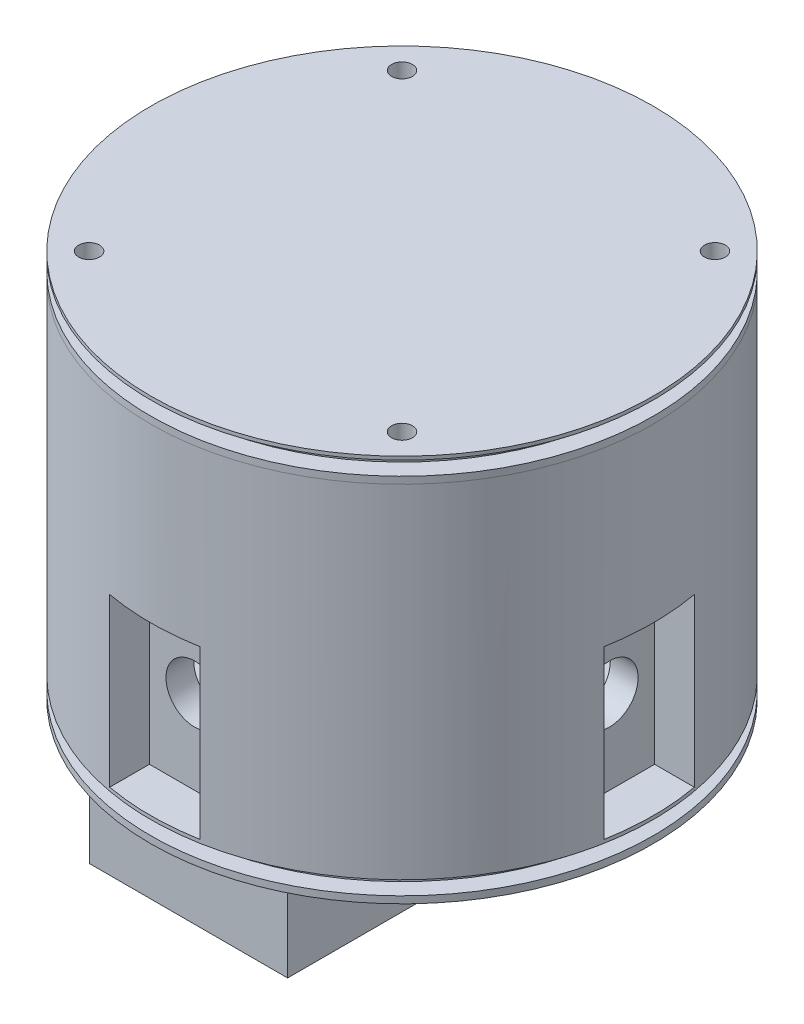
from build123d import *

# Parameters (mm, degrees)
EXTRUDE_START            = -2
SKETCH_1_R               = 72.25
EXTRUDE_8_DEPTH          = 99.5
SKETCH_5_W               = 10.5
SKETCH_5_H               = 22
SKETCH_5_W_2             = 22
SKETCH_5_H_2             = 10.5
CUT_EXTRUDE_1_DEPTH      = 48
SKETCH_40_R              = 8.25
CUT_EXTRUDE_2_DEPTH      = 8
PATTERN_CIRCULAR_1_COUNT = 4
SHELL_START              = -49.642711667
SHELL_6_OUTLINE_W        = 30
SHELL_6_OUTLINE_H        = 50
SHELL_6_DEPTH            = 99.285423334
SHELL_START_2            = -57.642711667
SHELL_6_2_OUTLINE_W      = 30
SHELL_6_2_OUTLINE_H      = 50
SHELL_6_2_OUTLINE_R      = 10.25
SHELL_6_2_DEPTH          = 115.285423334
SHELL_6_3_OUTLINE_W      = 50
SHELL_6_3_OUTLINE_H      = 30
SHELL_6_3_DEPTH          = 99.285423334
SHELL_6_4_OUTLINE_W      = 50
SHELL_6_4_OUTLINE_H      = 30
SHELL_6_4_OUTLINE_R      = 10.25
SHELL_6_4_DEPTH          = 115.285423334
SHELL_6_5_DEPTH          = 97.5
SHELL_START_3            = 50
SHELL_6_6_DEPTH          = 47.5
CUT_EXTRUDE_5_DEPTH      = 48
SKETCH_37_W              = 68
SKETCH_37_H              = 1.5
EXTRUDE_9_DEPTH          = 34
EXTRUDE_9_2_DEPTH        = 34
EXTRUDE_9_3_DEPTH        = 34
EXTRUDE_9_4_DEPTH        = 34
EXTRUDE_9_5_DEPTH        = 34
EXTRUDE_10_DEPTH         = 65
EXTRUDE_11_DEPTH         = 55
EXTRUDE_START_2          = -6
SKETCH_1_26_R            = 72.25
EXTRUDE_13_DEPTH         = 6
SKETCH_47_W              = 57
SKETCH_47_H              = 106
EXTRUDE_12_DEPTH         = 34
SKETCH_50_R              = 6
CUT_EXTRUDE_6_DEPTH      = 6
EXTRUDE_START_3          = 91.5
SKETCH_1_36_R            = 72.25
SKETCH_1_36_R_2          = 71
SKETCH_1_36_R_3          = 68
EXTRUDE_19_DEPTH         = 6
SKETCH_61_R              = 1.5
CUT_EXTRUDE_10_DEPTH     = 6
CUT_EXTRUDE_START        = 95.5
SKETCH_1_37_R            = 71
SKETCH_1_37_R_2          = 68
CUT_EXTRUDE_11_DEPTH     = 2
EXTRUDE_START_4          = -103.5
EXTRUDE_20_DEPTH         = 6
EXTRUDE_20_2_DEPTH       = 6
EXTRUDE_20_3_DEPTH       = 6
EXTRUDE_20_4_DEPTH       = 6
SKETCH_62_W              = 5
SKETCH_62_H              = 4
SKETCH_63_R              = 1.5
CUT_EXTRUDE_12_DEPTH     = 6
EXTRUDE_START_5          = 97.5
SKETCH_1_39_R            = 72.25
EXTRUDE_22_DEPTH         = 7
SKETCH_64_R              = 3
CUT_EXTRUDE_13_DEPTH     = 6
SKETCH_63_2_R            = 1.5
CUT_EXTRUDE_14_DEPTH     = 6
CUT_EXTRUDE_START_2      = -6
SKETCH_65_R              = 1.5
CUT_EXTRUDE_15_DEPTH     = 6
EXTRUDE_START_6          = -7
SKETCH_1_40_R            = 72.25
EXTRUDE_23_DEPTH         = 1
SKETCH_66_W              = 5
SKETCH_66_H              = 4
SKETCH_1_41_R            = 68
SKETCH_1_41_R_2          = 67
EXTRUDE_24_DEPTH         = 6


with BuildPart() as part:
    # 草圖1 → 填料-伸長8 (new body)
    with BuildSketch(Plane(origin=(0, 0, 0), x_dir=(1, 0, 0), z_dir=(0, 1, 0)).offset(EXTRUDE_START)):
        with Locations(Location((0, 0, 0), (0, 0, 270))):
            Circle(SKETCH_1_R)
    extrude(amount=EXTRUDE_8_DEPTH)

    # 草圖5 → 除料-伸長1 (cut)
    with BuildSketch(Plane(origin=(0, 0, 0), x_dir=(1, 0, 0), z_dir=(0, 1, 0))):
        with Locations((64.892711667, 0)):
            Rectangle(SKETCH_5_W, SKETCH_5_H)
        with BuildLine():
            ThreePointArc((72.25, 0), (71.954602966, 6.526684613), (71.070827348, 13))
            Line((71.070827348, 13), (59.642711667, 13))
            Line((59.642711667, 13), (59.642711667, 11))
            Line((59.642711667, 11), (70.142711667, 11))
            Line((70.142711667, 11), (70.142711667, -11))
            Line((70.142711667, -11), (59.642711667, -11))
            Line((59.642711667, -11), (59.642711667, -13))
            Line((59.642711667, -13), (71.070827348, -13))
            ThreePointArc((71.070827348, -13), (71.954602966, -6.526684613), (72.25, 0))
        make_face()
        with Locations((0, 64.892711667)):
            Rectangle(SKETCH_5_W_2, SKETCH_5_H_2)
        with BuildLine():
            ThreePointArc((13, 71.070827348), (0, 72.25), (-13, 71.070827348))
            Line((-13, 71.070827348), (-13, 59.642711667))
            Line((-13, 59.642711667), (-11, 59.642711667))
            Line((-11, 59.642711667), (-11, 70.142711667))
            Line((-11, 70.142711667), (11, 70.142711667))
            Line((11, 70.142711667), (11, 59.642711667))
            Line((11, 59.642711667), (13, 59.642711667))
            Line((13, 59.642711667), (13, 71.070827348))
        make_face()
        with Locations((-64.892711667, 0)):
            Rectangle(SKETCH_5_W, SKETCH_5_H)
        with BuildLine():
            Line((-70.142711667, -11), (-70.142711667, 11))
            Line((-70.142711667, 11), (-59.642711667, 11))
            Line((-59.642711667, 11), (-59.642711667, 13))
            Line((-59.642711667, 13), (-71.070827348, 13))
            ThreePointArc((-71.070827348, 13), (-72.25, 0), (-71.070827348, -13))
            Line((-71.070827348, -13), (-59.642711667, -13))
            Line((-59.642711667, -13), (-59.642711667, -11))
            Line((-59.642711667, -11), (-70.142711667, -11))
        make_face()
        with Locations((0, -64.892711667)):
            Rectangle(SKETCH_5_W_2, SKETCH_5_H_2)
        with BuildLine():
            Line((-13, -59.642711667), (-13, -71.070827348))
            ThreePointArc((-13, -71.070827348), (0, -72.25), (13, -71.070827348))
            Line((13, -71.070827348), (13, -59.642711667))
            Line((13, -59.642711667), (11, -59.642711667))
            Line((11, -59.642711667), (11, -70.142711667))
            Line((11, -70.142711667), (-11, -70.142711667))
            Line((-11, -70.142711667), (-11, -59.642711667))
            Line((-11, -59.642711667), (-13, -59.642711667))
        make_face()
    extrude(amount=CUT_EXTRUDE_1_DEPTH, mode=Mode.SUBTRACT)

    # 草圖40 → 除料-伸長2 (cut)
    with BuildSketch(Plane(origin=(0, 0, -59.642711667), x_dir=(-1, 0, 0), z_dir=(0, 0, -1))):
        with Locations((0, 24)):
            Circle(SKETCH_40_R)
    cut_extrude_2 = extrude(amount=-CUT_EXTRUDE_2_DEPTH, mode=Mode.SUBTRACT)

    # 環狀複製排列1: 除料-伸長2 ×4 about axis
    pattern_circular_1_axis = Axis((0, 0, 0), (0, 1, 0))
    for i in range(1, PATTERN_CIRCULAR_1_COUNT):
        add(cut_extrude_2.rotate(pattern_circular_1_axis, i * 360 / PATTERN_CIRCULAR_1_COUNT), mode=Mode.SUBTRACT)

    # 薄殼6: read off the stored shape, not the designer's step
    # 薄殼6 outline → 薄殼6 (cut)
    with BuildSketch(Plane.XY.offset(SHELL_START)):
        with Locations((0, 25)):
            Rectangle(SHELL_6_OUTLINE_W, SHELL_6_OUTLINE_H)
    extrude(amount=SHELL_6_DEPTH, mode=Mode.SUBTRACT)

    # Shell 6 2 outline → Shell 6 2 (cut)
    with BuildSketch(Plane.XY.offset(SHELL_START_2)):
        with Locations((0, 25)):
            Rectangle(SHELL_6_2_OUTLINE_W, SHELL_6_2_OUTLINE_H)
        with Locations((0, 24)):
            Circle(SHELL_6_2_OUTLINE_R, mode=Mode.SUBTRACT)
    extrude(amount=SHELL_6_2_DEPTH, mode=Mode.SUBTRACT)

    # Shell 6 3 outline → Shell 6 3 (cut)
    with BuildSketch(Plane.YZ.offset(SHELL_START)):
        with Locations((25, 0)):
            Rectangle(SHELL_6_3_OUTLINE_W, SHELL_6_3_OUTLINE_H)
    extrude(amount=SHELL_6_3_DEPTH, mode=Mode.SUBTRACT)

    # Shell 6 4 outline → Shell 6 4 (cut)
    with BuildSketch(Plane.YZ.offset(SHELL_START_2)):
        with Locations((25, 0)):
            Rectangle(SHELL_6_4_OUTLINE_W, SHELL_6_4_OUTLINE_H)
        with Locations((24, 0)):
            Circle(SHELL_6_4_OUTLINE_R, mode=Mode.SUBTRACT)
    extrude(amount=SHELL_6_4_DEPTH, mode=Mode.SUBTRACT)

    # Shell 6 5 outline → Shell 6 5 (cut)
    with BuildSketch(Plane(origin=(0, 0, 0), x_dir=(1, 0, 0), z_dir=(0, 1, 0))):
        with BuildLine():
            Line((15, 15), (68.62989509, 15))
            ThreePointArc((68.62989509, 15), (49.674251378, 49.674251378), (15, 68.62989509))
            Line((15, 68.62989509), (15, 15))
        make_face()
        with BuildLine():
            ThreePointArc((15, -68.62989509), (49.674251378, -49.674251378), (68.62989509, -15))
            Line((68.62989509, -15), (15, -15))
            Line((15, -15), (15, -68.62989509))
        make_face()
        with BuildLine():
            Line((-15, 15), (-15, 68.62989509))
            ThreePointArc((-15, 68.62989509), (-49.674251378, 49.674251378), (-68.62989509, 15))
            Line((-68.62989509, 15), (-15, 15))
        make_face()
        with BuildLine():
            ThreePointArc((-68.62989509, -15), (-49.674251378, -49.674251378), (-15, -68.62989509))
            Line((-15, -68.62989509), (-15, -15))
            Line((-15, -15), (-68.62989509, -15))
        make_face()
    extrude(amount=SHELL_6_5_DEPTH, mode=Mode.SUBTRACT)

    # Shell 6 6 outline → Shell 6 6 (cut)
    with BuildSketch(Plane(origin=(0, 0, 0), x_dir=(1, 0, 0), z_dir=(0, 1, 0)).offset(SHELL_START_3)):
        with BuildLine():
            ThreePointArc((68.62989509, -15), (70.25, 0), (68.62989509, 15))
            Line((68.62989509, 15), (15, 15))
            Line((15, 15), (15, 68.62989509))
            ThreePointArc((15, 68.62989509), (0, 70.25), (-15, 68.62989509))
            Line((-15, 68.62989509), (-15, 15))
            Line((-15, 15), (-68.62989509, 15))
            ThreePointArc((-68.62989509, 15), (-70.25, 0), (-68.62989509, -15))
            Line((-68.62989509, -15), (-15, -15))
            Line((-15, -15), (-15, -68.62989509))
            ThreePointArc((-15, -68.62989509), (0, -70.25), (15, -68.62989509))
            Line((15, -68.62989509), (15, -15))
            Line((15, -15), (68.62989509, -15))
        make_face()
    extrude(amount=SHELL_6_6_DEPTH, mode=Mode.SUBTRACT)

    # 草圖43 → 除料-伸長5 (cut)
    with BuildSketch(Plane(origin=(0, 0, 0), x_dir=(1, 0, 0), z_dir=(0, 1, 0))):
        Polygon((15.617248129, 51.642711667), (-24.146545114, 51.642711667), (-51.642711667, 15.617248129), (-51.642711667, -24.146545114), (-15.617248129, -51.642711667), (24.146545114, -51.642711667), (51.642711667, -15.617248129), (51.642711667, 24.146545114), align=None)
    extrude(amount=CUT_EXTRUDE_5_DEPTH, mode=Mode.SUBTRACT)

    # 草圖1<26> → 填料-伸長13 (add)
    with BuildSketch(Plane(origin=(0, 0, 0), x_dir=(1, 0, 0), z_dir=(0, 1, 0)).offset(EXTRUDE_START_2)):
        with Locations(Location((0, 0, 0), (0, 0, 270))):
            Circle(SKETCH_1_26_R)
    extrude(amount=EXTRUDE_13_DEPTH)

    # 草圖50 → 除料-伸長6 (cut)
    with BuildSketch(Plane(origin=(0, 0, 0), x_dir=(1, 0, 0), z_dir=(0, 1, 0))):
        with Locations(Location((18.322761596, 49.972985564, 0), (0, 0, 270))):
            Circle(SKETCH_50_R)
        with Locations(Location((-49.972985564, -18.322761596, 0), (0, 0, 270))):
            Circle(SKETCH_50_R)
    extrude(amount=-CUT_EXTRUDE_6_DEPTH, mode=Mode.SUBTRACT)

    # 草圖1<36> → 填料-伸長19 (add)
    # profile 1 of 2: a face of its own
    with BuildSketch(Plane(origin=(0, 0, 0), x_dir=(1, 0, 0), z_dir=(0, 1, 0)).offset(EXTRUDE_START_3)):
        with Locations(Location((0, 0, 0), (0, 0, 270))):
            Circle(SKETCH_1_36_R)
        Circle(SKETCH_1_36_R_2, mode=Mode.SUBTRACT)
    # profile 2 of 2: a face of its own
    with BuildSketch(Plane(origin=(0, 0, 0), x_dir=(1, 0, 0), z_dir=(0, 1, 0)).offset(EXTRUDE_START_3)):
        Circle(SKETCH_1_36_R_2)
        with Locations(Location((0, 0, 0), (0, 0, 270))):
            Circle(SKETCH_1_36_R_3, mode=Mode.SUBTRACT)
    extrude(amount=EXTRUDE_19_DEPTH)

    # 草圖61 → 除料-伸長10 (cut)
    with BuildSketch(Plane(origin=(0, 0, 0), x_dir=(1, 0, 0), z_dir=(0, 1, 0))):
        with Locations(Location((42.426406871, 0, 0), (0, 0, 270))):
            Circle(SKETCH_61_R)
        with Locations(Location((0, -42.426406871, 0), (0, 0, 270))):
            Circle(SKETCH_61_R)
        with Locations(Location((-42.426406871, 0, 0), (0, 0, 270))):
            Circle(SKETCH_61_R)
        with Locations(Location((0, 42.426406871, 0), (0, 0, 270))):
            Circle(SKETCH_61_R)
    extrude(amount=-CUT_EXTRUDE_10_DEPTH, mode=Mode.SUBTRACT)

    # 草圖1<37> → 除料-伸長11 (cut)
    with BuildSketch(Plane(origin=(0, 0, 0), x_dir=(1, 0, 0), z_dir=(0, 1, 0)).offset(CUT_EXTRUDE_START)):
        with Locations(Location((0, 0, 0), (0, 0, 270))):
            Circle(SKETCH_1_37_R)
        with Locations(Location((0, 0, 0), (0, 0, 270))):
            Circle(SKETCH_1_37_R_2, mode=Mode.SUBTRACT)
    extrude(amount=CUT_EXTRUDE_11_DEPTH, mode=Mode.SUBTRACT)

    # 草圖62 → 除料-旋轉2 (revolve, cut)
    with BuildSketch(Plane(origin=(0, 0, 0), x_dir=(-0.7071067811865476, 0, 0.7071067811865476), z_dir=(-0.7071067811865476, 0, -0.7071067811865476)), mode=Mode.PRIVATE) as cut_revolve_2_sk:
        with Locations((-69.75, -3)):
            Rectangle(SKETCH_62_W, SKETCH_62_H)
    revolve(cut_revolve_2_sk.sketch.rotate(Axis((0, 0, 0), (0, 1, 0)), 45), axis=Axis((0, 0, 0), (0, 1, 0)), mode=Mode.SUBTRACT)

    # 草圖1<40> → 填料-伸長23 (add)
    with BuildSketch(Plane(origin=(0, 0, 0), x_dir=(1, 0, 0), z_dir=(0, 1, 0)).offset(EXTRUDE_START_6)):
        with Locations(Location((0, 0, 0), (0, 0, 270))):
            Circle(SKETCH_1_40_R)
    extrude(amount=EXTRUDE_23_DEPTH)



with BuildPart() as body_2:
    # 草圖37 → 填料-伸長9 (new, symmetric)
    with BuildSketch(Plane(origin=(0, 0, 0), x_dir=(-0.7071067811865476, 0, 0.7071067811865476), z_dir=(-0.7071067811865476, 0, -0.7071067811865476))):
        with Locations((0, 48.75)):
            Rectangle(SKETCH_37_W, SKETCH_37_H)
    extrude(amount=EXTRUDE_9_DEPTH, both=True)


with BuildPart() as body_3:
    # 草圖37 → Extrude 9 2 (new, symmetric)
    with BuildSketch(Plane(origin=(0, 0, 0), x_dir=(-0.7071067811865476, 0, 0.7071067811865476), z_dir=(-0.7071067811865476, 0, -0.7071067811865476))):
        Polygon((-34, 33), (-34, 31.5), (-31.5, 31.5), (34, 31.5), (34, 33), align=None)
    extrude(amount=EXTRUDE_9_2_DEPTH, both=True)


with BuildPart() as body_4:
    # 草圖37 → Extrude 9 3 (new, symmetric)
    with BuildSketch(Plane(origin=(0, 0, 0), x_dir=(-0.7071067811865476, 0, 0.7071067811865476), z_dir=(-0.7071067811865476, 0, -0.7071067811865476))):
        Polygon((-34, 16.5), (-34, 15), (34, 15), (34, 16.5), (-31.5, 16.5), align=None)
    extrude(amount=EXTRUDE_9_3_DEPTH, both=True)


with BuildPart() as body_5:
    # 草圖37 → Extrude 9 4 (new, symmetric)
    with BuildSketch(Plane(origin=(0, 0, 0), x_dir=(-0.7071067811865476, 0, 0.7071067811865476), z_dir=(-0.7071067811865476, 0, -0.7071067811865476))):
        with Locations((0, 65.25)):
            Rectangle(SKETCH_37_W, SKETCH_37_H)
    extrude(amount=EXTRUDE_9_4_DEPTH, both=True)


with BuildPart() as body_6:
    # 草圖37 → Extrude 9 5 (new, symmetric)
    with BuildSketch(Plane(origin=(0, 0, 0), x_dir=(-0.7071067811865476, 0, 0.7071067811865476), z_dir=(-0.7071067811865476, 0, -0.7071067811865476))):
        with Locations((0, 81.75)):
            Rectangle(SKETCH_37_W, SKETCH_37_H)
    extrude(amount=EXTRUDE_9_5_DEPTH, both=True)


with BuildPart() as body_7:
    # 草圖41 → 填料-伸長10 (new body)
    with BuildSketch(Plane(origin=(0, 0, 0), x_dir=(1, 0, 0), z_dir=(0, 1, 0))):
        Polygon((48.371425758, -10.597532563), (10.187659574, -48.781298747), (22.915581635, -61.509220808), (61.099347819, -23.325454624), align=None)
    extrude(amount=EXTRUDE_10_DEPTH)


with BuildPart() as body_8:
    # 草圖46 → 填料-伸長11 (new body)
    with BuildSketch(Plane(origin=(0, 0, 0), x_dir=(1, 0, 0), z_dir=(0, 1, 0))):
        Polygon((-21.653402574, -57.008741633), (-22.714062746, -58.069401805), (-58.069401805, -22.714062746), (-57.008741633, -21.653402574), align=None)
    extrude(amount=EXTRUDE_11_DEPTH)


with BuildPart() as body_9:
    # 草圖47 → 填料-伸長12 (new body)
    with BuildSketch(Plane(origin=(0, 0, 0), x_dir=(1, 0, 0), z_dir=(0, 1, 0)).offset(EXTRUDE_START_2)):
        with Locations((-8.402499724, 0)):
            Rectangle(SKETCH_47_W, SKETCH_47_H)
    extrude(amount=-EXTRUDE_12_DEPTH)


with BuildPart() as body_10:
    # 草圖57 → 填料-伸長20 (new body)
    with BuildSketch(Plane.XZ.offset(6).offset(EXTRUDE_START_4)):
        with BuildLine():
            Line((-49.280774487, 45.39168719), (-45, 41.110912703))
            Line((-45, 41.110912703), (-41.110912703, 45))
            Line((-41.110912703, 45), (-45.39168719, 49.280774487))
            ThreePointArc((-45.39168719, 49.280774487), (-47.376154339, 47.376154339), (-49.280774487, 45.39168719))
        make_face()
    extrude(amount=EXTRUDE_20_DEPTH)


with BuildPart() as body_11:
    # 草圖57 → Extrude 20 2 (new body)
    with BuildSketch(Plane.XZ.offset(6).offset(EXTRUDE_START_4)):
        with BuildLine():
            Line((-45, -41.110912703), (-49.280774487, -45.39168719))
            ThreePointArc((-49.280774487, -45.39168719), (-47.376154339, -47.376154339), (-45.39168719, -49.280774487))
            Line((-45.39168719, -49.280774487), (-41.110912703, -45))
            Line((-41.110912703, -45), (-45, -41.110912703))
        make_face()
    extrude(amount=EXTRUDE_20_2_DEPTH)


with BuildPart() as body_12:
    # 草圖57 → Extrude 20 3 (new body)
    with BuildSketch(Plane.XZ.offset(6).offset(EXTRUDE_START_4)):
        with BuildLine():
            Line((41.110912703, -45), (45.39168719, -49.280774487))
            ThreePointArc((45.39168719, -49.280774487), (47.376154339, -47.376154339), (49.280774487, -45.39168719))
            Line((49.280774487, -45.39168719), (45, -41.110912703))
            Line((45, -41.110912703), (41.110912703, -45))
        make_face()
    extrude(amount=EXTRUDE_20_3_DEPTH)


with BuildPart() as body_13:
    # 草圖57 → Extrude 20 4 (new body)
    with BuildSketch(Plane.XZ.offset(6).offset(EXTRUDE_START_4)):
        with BuildLine():
            ThreePointArc((49.280774487, 45.39168719), (47.376154339, 47.376154339), (45.39168719, 49.280774487))
            Line((45.39168719, 49.280774487), (41.110912703, 45))
            Line((41.110912703, 45), (45, 41.110912703))
            Line((45, 41.110912703), (49.280774487, 45.39168719))
        make_face()
    extrude(amount=EXTRUDE_20_4_DEPTH)


with BuildPart() as cut_extrude_12_tool:
    # 草圖63 → 除料-伸長12 (new body)
    with BuildSketch(Plane(origin=(0, 97.5, 0), x_dir=(1, 0, 0), z_dir=(0, 1, 0))):
        with Locations(Location((-45, 45, 0), (0, 0, 270))):
            Circle(SKETCH_63_R)
        with Locations(Location((45, 45, 0), (0, 0, 270))):
            Circle(SKETCH_63_R)
        with Locations(Location((45, -45, 0), (0, 0, 270))):
            Circle(SKETCH_63_R)
        with Locations(Location((-45, -45, 0), (0, 0, 270))):
            Circle(SKETCH_63_R)
    extrude(amount=-CUT_EXTRUDE_12_DEPTH)


with BuildPart() as body_10_1:
    add(body_10.part)

    # 除料-伸長12: cut by cut_extrude_12_tool
    add(cut_extrude_12_tool.part, mode=Mode.SUBTRACT)


with BuildPart() as body_11_1:
    add(body_11.part)

    # 除料-伸長12: cut by cut_extrude_12_tool
    add(cut_extrude_12_tool.part, mode=Mode.SUBTRACT)


with BuildPart() as body_12_1:
    add(body_12.part)

    # 除料-伸長12: cut by cut_extrude_12_tool
    add(cut_extrude_12_tool.part, mode=Mode.SUBTRACT)


with BuildPart() as body_13_1:
    add(body_13.part)

    # 除料-伸長12: cut by cut_extrude_12_tool
    add(cut_extrude_12_tool.part, mode=Mode.SUBTRACT)


with BuildPart() as body_14:
    # 草圖1<39> → 填料-伸長22 (new body)
    with BuildSketch(Plane(origin=(0, 0, 0), x_dir=(1, 0, 0), z_dir=(0, 1, 0)).offset(EXTRUDE_START_5)):
        with Locations(Location((0, 0, 0), (0, 0, 270))):
            Circle(SKETCH_1_39_R)
    extrude(amount=EXTRUDE_22_DEPTH)

    # 草圖64 → 除料-伸長13 (cut)
    with BuildSketch(Plane(origin=(0, 104.5, 0), x_dir=(1, 0, 0), z_dir=(0, 1, 0))):
        with Locations(Location((-45, 45, 0), (0, 0, 270))):
            Circle(SKETCH_64_R)
        with Locations(Location((45, 45, 0), (0, 0, 270))):
            Circle(SKETCH_64_R)
        with Locations(Location((45, -45, 0), (0, 0, 270))):
            Circle(SKETCH_64_R)
        with Locations(Location((-45, -45, 0), (0, 0, 270))):
            Circle(SKETCH_64_R)
    extrude(amount=-CUT_EXTRUDE_13_DEPTH, mode=Mode.SUBTRACT)

    # 草圖63<2> → 除料-伸長14 (cut)
    with BuildSketch(Plane(origin=(0, 97.5, 0), x_dir=(1, 0, 0), z_dir=(0, 1, 0))):
        with Locations(Location((-45, 45, 0), (0, 0, 270))):
            Circle(SKETCH_63_2_R)
        with Locations(Location((45, 45, 0), (0, 0, 270))):
            Circle(SKETCH_63_2_R)
        with Locations(Location((45, -45, 0), (0, 0, 270))):
            Circle(SKETCH_63_2_R)
        with Locations(Location((-45, -45, 0), (0, 0, 270))):
            Circle(SKETCH_63_2_R)
    extrude(amount=CUT_EXTRUDE_14_DEPTH, mode=Mode.SUBTRACT)

    # 草圖65 → 除料-伸長15 (cut)
    with BuildSketch(Plane.XZ.offset(-97.5).offset(CUT_EXTRUDE_START_2)):
        with Locations(Location((-42.426406871, 0, 0), (0, 0, 270))):
            Circle(SKETCH_65_R)
        with Locations(Location((0, 42.426406871, 0), (0, 0, 270))):
            Circle(SKETCH_65_R)
        with Locations(Location((42.426406871, 0, 0), (0, 0, 270))):
            Circle(SKETCH_65_R)
        with Locations(Location((0, -42.426406871, 0), (0, 0, 270))):
            Circle(SKETCH_65_R)
    extrude(amount=CUT_EXTRUDE_15_DEPTH, mode=Mode.SUBTRACT)

    # 草圖66 → 除料-旋轉3 (revolve, cut)
    with BuildSketch(Plane(origin=(0, 0, 0), x_dir=(-0.7071067811865476, 0, 0.7071067811865476), z_dir=(-0.7071067811865476, 0, -0.7071067811865476)), mode=Mode.PRIVATE) as cut_revolve_3_sk:
        with Locations((-69.75, 101.5)):
            Rectangle(SKETCH_66_W, SKETCH_66_H)
    revolve(cut_revolve_3_sk.sketch.rotate(Axis((0, 0, 0), (0, 1, 0)), 45), axis=Axis((0, 0, 0), (0, 1, 0)), mode=Mode.SUBTRACT)


with BuildPart() as part_1:
    add(part.part)

    add(body_13_1.part)  # 填料-伸長24 merges body 13

    add(body_10_1.part)  # 填料-伸長24 merges body 10

    add(body_12_1.part)  # 填料-伸長24 merges body 12

    add(body_11_1.part)  # 填料-伸長24 merges body 11
    # 草圖1<41> → 填料-伸長24 (add)
    with BuildSketch(Plane(origin=(0, 0, 0), x_dir=(1, 0, 0), z_dir=(0, 1, 0)).offset(EXTRUDE_START_3)):
        with Locations(Location((0, 0, 0), (0, 0, 270))):
            Circle(SKETCH_1_41_R)
        Circle(SKETCH_1_41_R_2, mode=Mode.SUBTRACT)
    extrude(amount=EXTRUDE_24_DEPTH)


solid = Compound([body_2.part, body_3.part, body_4.part, body_5.part, body_6.part, body_7.part, body_8.part, body_9.part, body_14.part, part_1.part])
